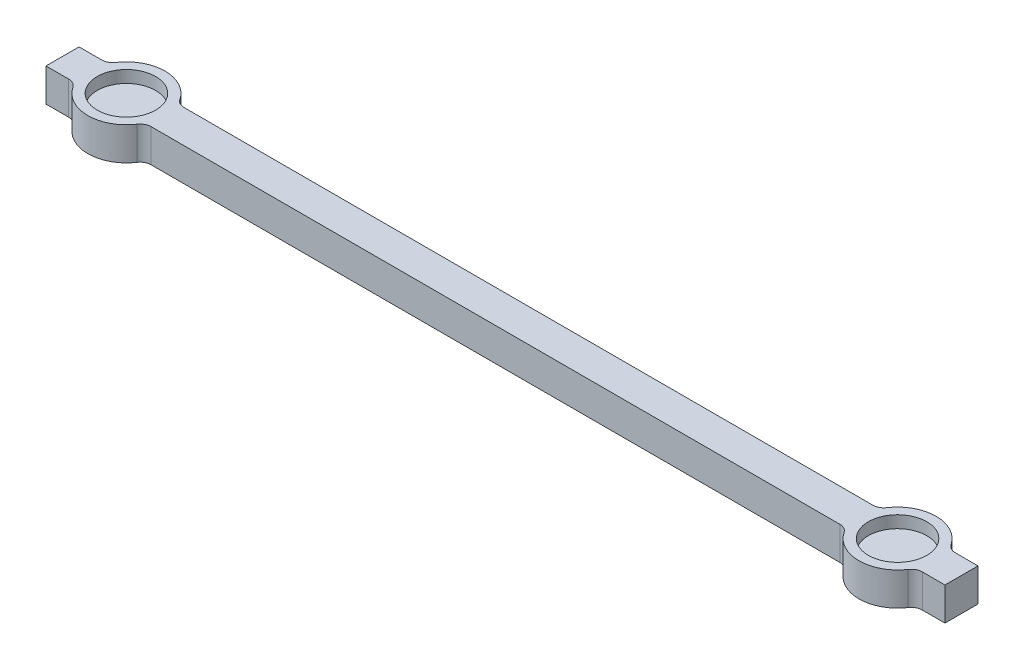
from build123d import *

# Parameters (mm, degrees)
SKETCH1_R          = 3.5
SKETCH1_W          = 81.6
SKETCH1_H          = 3
BASE_SHAPE_DEPTH   = 3
SKETCH2_R          = 2.65
MAGNET_HOLES_DEPTH = 1.1
MILLING_FILLETS_R  = 1


with BuildPart() as part:
    # Sketch1 → Base shape (new body)
    with BuildSketch(Plane(origin=(0, 0, 0), x_dir=(1, 0, 0), z_dir=(0, 1, 0))):
        with Locations((-35, 0)):
            Circle(SKETCH1_R)
        with Locations((35, 0)):
            Circle(SKETCH1_R)
        Rectangle(SKETCH1_W, SKETCH1_H)
    extrude(amount=BASE_SHAPE_DEPTH)

    # Sketch2 → Magnet holes (cut)
    with BuildSketch(Plane(origin=(0, 3, 0), x_dir=(1, 0, 0), z_dir=(0, 1, 0))):
        with Locations((-35, 0)):
            Circle(SKETCH2_R)
        with Locations((35, 0)):
            Circle(SKETCH2_R)
    extrude(amount=-MAGNET_HOLES_DEPTH, mode=Mode.SUBTRACT)

    # Milling fillets
    milling_fillets_edges = [part.edges().sort_by_distance(p)[0] for p in [
        (31.83772234, 1.5, -1.5),
        (-38.16227766, 1.5, -1.5),
        (-31.83772234, 1.5, -1.5),
        (38.16227766, 1.5, -1.5),
        (38.16227766, 1.5, 1.5),
        (31.83772234, 1.5, 1.5),
        (-31.83772234, 1.5, 1.5),
        (-38.16227766, 1.5, 1.5),
    ]]
    fillet(milling_fillets_edges, radius=MILLING_FILLETS_R)


solid = part.part
